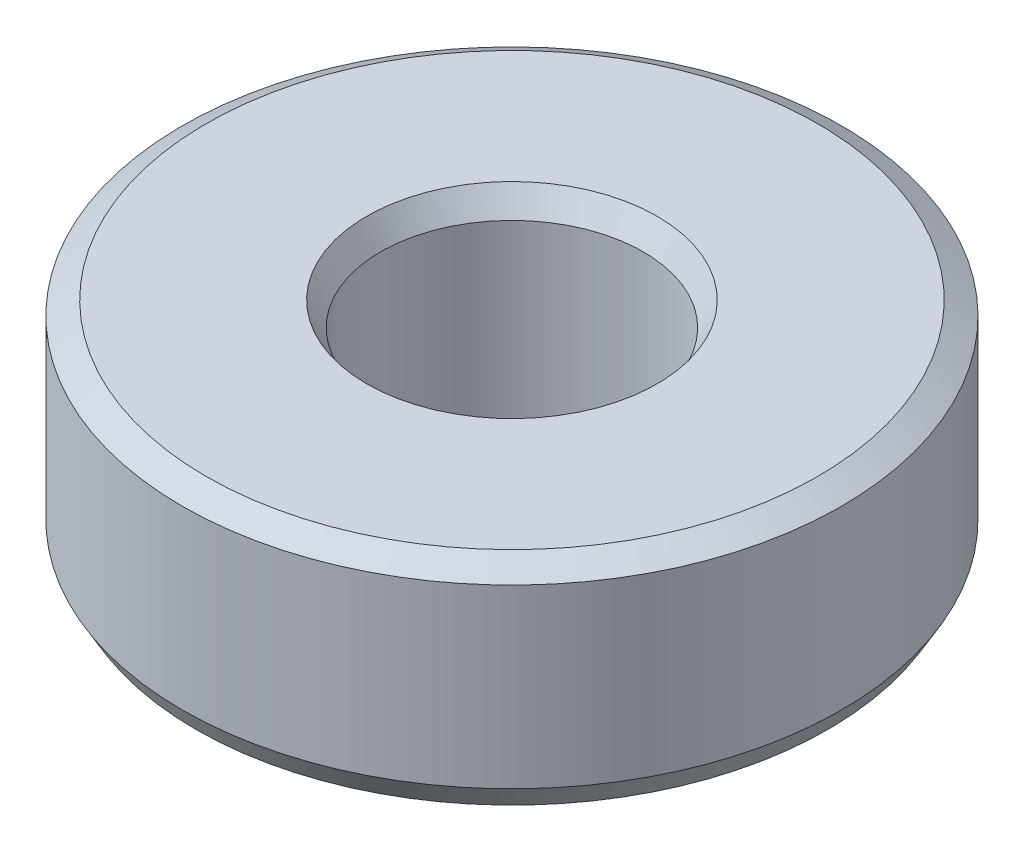
from build123d import *
from OCP.BRepFilletAPI import BRepFilletAPI_MakeChamfer

# Parameters (mm, degrees)
SKETCH1_R           = 37.5
BOSS_EXTRUDE1_DEPTH = 24.368091303
SKETCH2_R           = 14.950718376
CUT_EXTRUDE1_DEPTH  = 59.363549187
CHAMFER1_SIZE       = 1.57076462
CHAMFER1_SIZE2      = 2.720644128


with BuildPart() as part:
    # Sketch1 → Boss-Extrude1 (new body)
    with BuildSketch(Plane(origin=(0, 0, 0), x_dir=(1, 0, 0), z_dir=(0, 1, 0))):
        Circle(SKETCH1_R)
    extrude(amount=BOSS_EXTRUDE1_DEPTH)

    # Sketch2 → Cut-Extrude1 (cut, through all)
    with BuildSketch(Plane(origin=(0, 0, 0), x_dir=(1, 0, 0), z_dir=(0, 1, 0))):
        Circle(SKETCH2_R)
    extrude(amount=CUT_EXTRUDE1_DEPTH, mode=Mode.SUBTRACT)

    # Chamfer1: one chamfer whose edges measure the first distance from different faces: ONE call of the kernel's chamfer builder (chamfer() names one face for all edges)
    chamfer1_edges_1 = [part.edges().sort_by_distance(p)[0] for p in [
        (-14.950718376, 24.368091303, 0),
    ]]
    chamfer1_side_1 = [part.faces().sort_by_distance(p)[0] for p in [
        (-36.439339828, 24.368091303, 0),
    ]]
    chamfer1_edges_2 = [part.edges().sort_by_distance(p)[0] for p in [
        (-14.950718376, 0, 0),
    ]]
    chamfer1_side_2 = [part.faces().sort_by_distance(p)[0] for p in [
        (-14.950718376, 12.184045652, 0),
    ]]
    chamfer1_edges_3 = [part.edges().sort_by_distance(p)[0] for p in [
        (-37.5, 0, 0),
    ]]
    chamfer1_side_3 = [part.faces().sort_by_distance(p)[0] for p in [
        (-36.439339828, 0, 0),
    ]]
    chamfer1_edges_4 = [part.edges().sort_by_distance(p)[0] for p in [
        (-37.5, 24.368091303, 0),
    ]]
    chamfer1_side_4 = [part.faces().sort_by_distance(p)[0] for p in [
        (-37.5, 12.184045652, 0),
    ]]
    chamfer1 = BRepFilletAPI_MakeChamfer(part.part.solid().wrapped)
    for e in chamfer1_edges_1:
        chamfer1.Add(CHAMFER1_SIZE, CHAMFER1_SIZE2, e.wrapped, chamfer1_side_1[0].wrapped)  # the first distance lies on this face
    for e in chamfer1_edges_2:
        chamfer1.Add(CHAMFER1_SIZE, CHAMFER1_SIZE2, e.wrapped, chamfer1_side_2[0].wrapped)  # the first distance lies on this face
    for e in chamfer1_edges_3:
        chamfer1.Add(CHAMFER1_SIZE, CHAMFER1_SIZE2, e.wrapped, chamfer1_side_3[0].wrapped)  # the first distance lies on this face
    for e in chamfer1_edges_4:
        chamfer1.Add(CHAMFER1_SIZE, CHAMFER1_SIZE2, e.wrapped, chamfer1_side_4[0].wrapped)  # the first distance lies on this face
    add(Compound.cast(chamfer1.Shape()), mode=Mode.REPLACE)


solid = part.part
